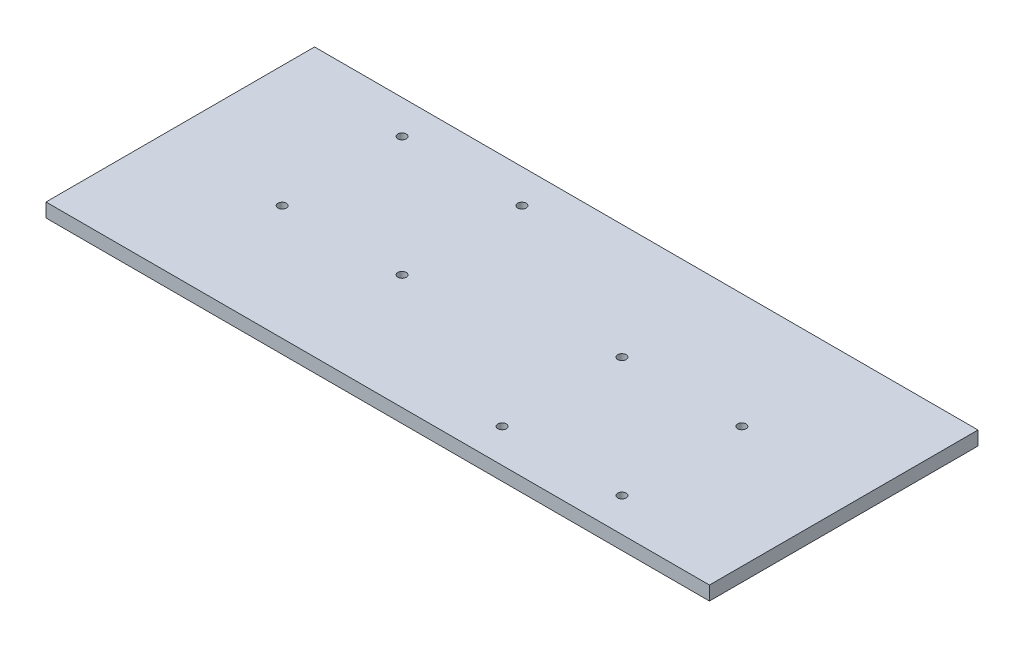
from build123d import *

# Parameters (mm, degrees)
SKETCH1_W            = 266.7
SKETCH1_H            = 107.95
BOSS_EXTRUDE1_DEPTH  = 5.588
M3_CLEARANCE_HOLE1_D = 3.4


with BuildPart() as part:
    # Sketch1 → Boss-Extrude1 (new body)
    with BuildSketch(Plane(origin=(0, 0, 0), x_dir=(1, 0, 0), z_dir=(0, 1, 0))):
        Rectangle(SKETCH1_W, SKETCH1_H)
    extrude(amount=BOSS_EXTRUDE1_DEPTH)

    # M3 Clearance Hole1 (through all)
    with Locations(Plane(origin=(0, 5.588, 0), x_dir=(1, 0, 0), z_dir=(0, 1, 0))):
        with Locations((-84.612, -7.775), (-84.612, 40.415), (-36.422, 40.415), (-36.422, -7.775), (84.612, 7.775), (84.612, -40.415), (36.422, -40.415), (36.422, 7.775)):
            Hole(M3_CLEARANCE_HOLE1_D / 2)


solid = part.part
